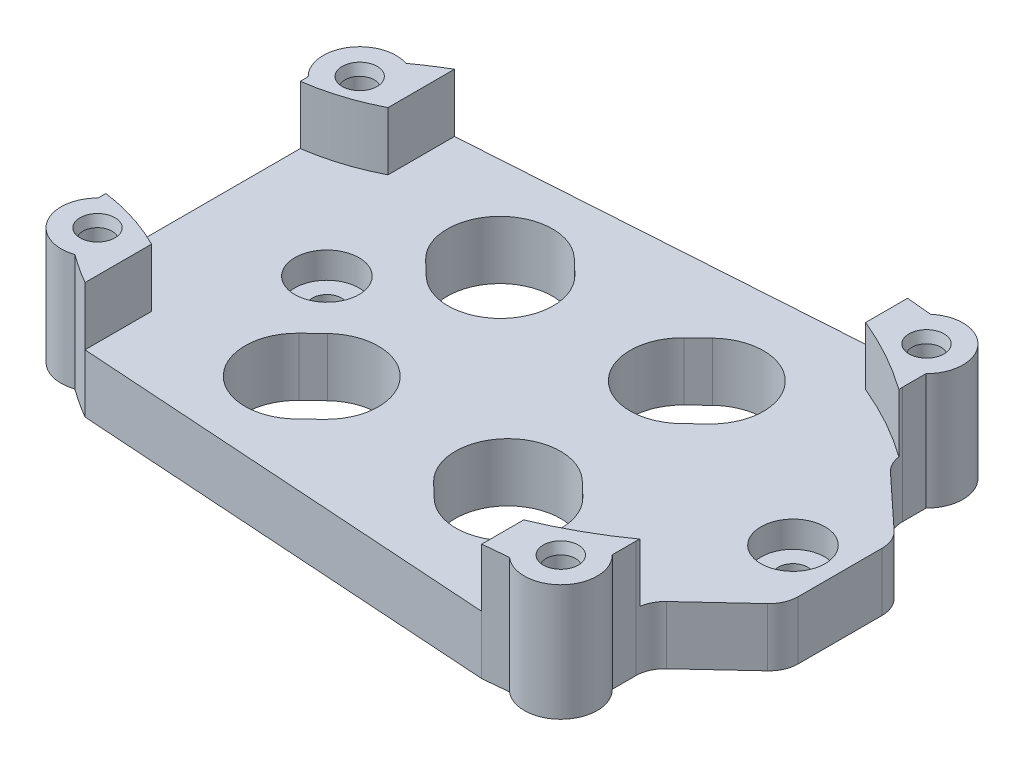
from build123d import *
from OCP.BRepFilletAPI import BRepFilletAPI_MakeChamfer

# Parameters (mm, degrees)
SKETCH1_R           = 1
BOSS_EXTRUDE1_DEPTH = 4
SKETCH1_5_R         = 1
BOSS_EXTRUDE2_DEPTH = 8
CUT_EXTRUDE1_DEPTH  = 7
SKETCH4_R           = 1
BOSS_EXTRUDE3_DEPTH = 4
SKETCH3_R           = 2
CUT_EXTRUDE2_DEPTH  = 1.8
MOVE_START          = 4
MOVE_FACE1_DEPTH    = 4
MOVE_FACE2_BY       = 0.2
MOVE_FACE2_2_BY     = 0.2
CHAMFER1_SIZE       = 0.7
CHAMFER1_SIZE2      = 0.2
CHAMFER2_SIZE       = 0.2
CHAMFER2_SIZE2      = 0.7
SKETCH5_R           = 1
CUT_EXTRUDE3_DEPTH  = 4
FILLET1_R           = 2


# Read off the part's stored shape, not the designer's step: Move Face1
with BuildPart() as part:
    # Sketch1 → Boss-Extrude1 (new body)
    with BuildSketch(Plane(origin=(0, 0, 0), x_dir=(1, 0, 0), z_dir=(0, 1, 0))):
        with BuildLine():
            Line((24.824168418, -41.434990566), (38.696876617, -40.141355505))
            ThreePointArc((38.696876617, -40.141355505), (42.164537627, -39.927592778), (42.070086822, -36.454633459))
            Line((42.070086822, -36.454633459), (42.070086822, -14.915347673))
            ThreePointArc((42.070086822, -14.915347673), (42.164537627, -11.442388354), (38.696876617, -11.228625627))
            Line((38.696876617, -11.228625627), (24.824168418, -9.934990566))
            ThreePointArc((24.824168418, -9.934990566), (14.849186159, -10.187088505), (5.767316865, -14.320304511))
            ThreePointArc((5.767316865, -14.320304511), (2.828547545, -15.371974531), (3.205984711, -18.470347673))
            Line((3.205984711, -18.470347673), (3.205984711, -32.899633459))
            ThreePointArc((3.205984711, -32.899633459), (2.828547545, -35.998006601), (5.767316865, -37.04967662))
            ThreePointArc((5.767316865, -37.04967662), (14.849186159, -41.182892626), (24.824168418, -41.434990566))
        make_face()
        with Locations(Location((4.955984711, -34.684990566, 0), (0, 0, 270))):
            Circle(SKETCH1_R, mode=Mode.SUBTRACT)
        with Locations(Location((24.824168418, -37.934990566, 0), (0, 0, 270))):
            Circle(SKETCH1_R, mode=Mode.SUBTRACT)
        with Locations(Location((40.320086822, -38.239990566, 0), (0, 0, 270))):
            Circle(SKETCH1_R, mode=Mode.SUBTRACT)
        with Locations(Location((4.955984711, -16.684990566, 0), (0, 0, 270))):
            Circle(SKETCH1_R, mode=Mode.SUBTRACT)
        with Locations(Location((24.824168418, -13.434990566, 0), (0, 0, 270))):
            Circle(SKETCH1_R, mode=Mode.SUBTRACT)
        with Locations(Location((40.320086822, -13.129990566, 0), (0, 0, 270))):
            Circle(SKETCH1_R, mode=Mode.SUBTRACT)
    extrude(amount=BOSS_EXTRUDE1_DEPTH)

    # Sketch1<5> → Boss-Extrude2 (add)
    # profile 1 of 8: a face of its own
    with BuildSketch(Plane(origin=(0, 0, 0), x_dir=(1, 0, 0), z_dir=(0, 1, 0))):
        with BuildLine():
            ThreePointArc((5.767316865, -37.04967662), (6.75947019, -37.734134037), (7.783460986, -38.369974447))
            Line((7.783460986, -38.369974447), (7.783460986, -33.244952788))
            ThreePointArc((7.783460986, -33.244952788), (6.373824255, -32.641654601), (4.909963227, -32.185414197))
            ThreePointArc((4.909963227, -32.185414197), (4.062798529, -31.99415486), (3.205984711, -31.852245597))
            Line((3.205984711, -31.852245597), (3.205984711, -32.899633459))
            Line((3.205984711, -32.899633459), (3.205984711, -34.684990566))
            ThreePointArc((3.205984711, -34.684990566), (3.718547844, -35.922427433), (4.955984711, -36.434990566))
            ThreePointArc((4.955984711, -36.434990566), (5.358522051, -36.746463253), (5.767316865, -37.04967662))
        make_face()
        with Locations(Location((4.955984711, -34.684990566, 0), (0, 0, 270))):
            Circle(SKETCH1_5_R, mode=Mode.SUBTRACT)
    # profile 2 of 8: a face of its own
    with BuildSketch(Plane(origin=(0, 0, 0), x_dir=(1, 0, 0), z_dir=(0, 1, 0))):
        with BuildLine():
            ThreePointArc((36.955984711, -14.488712586), (39.599003683, -15.793476237), (42.070086822, -17.400244917))
            Line((42.070086822, -17.400244917), (42.070086822, -14.915347673))
            Line((42.070086822, -14.915347673), (42.070086822, -13.129990566))
            ThreePointArc((42.070086822, -13.129990566), (41.557523689, -11.892553699), (40.320086822, -11.379990566))
            Line((40.320086822, -11.379990566), (38.696876617, -11.228625627))
            Line((38.696876617, -11.228625627), (36.955984711, -11.066286826))
            Line((36.955984711, -11.066286826), (36.955984711, -14.488712586))
        make_face()
        with Locations(Location((40.320086822, -13.129990566, 0), (0, 0, 270))):
            Circle(SKETCH1_5_R, mode=Mode.SUBTRACT)
    # profile 3 of 8: a face of its own
    with BuildSketch(Plane(origin=(0, 0, 0), x_dir=(1, 0, 0), z_dir=(0, 1, 0))):
        with BuildLine():
            Line((3.205984711, -18.470347673), (3.205984711, -19.517735535))
            ThreePointArc((3.205984711, -19.517735535), (5.55061073, -19.005071272), (7.783460986, -18.125028343))
            Line((7.783460986, -18.125028343), (7.783460986, -13.000006684))
            ThreePointArc((7.783460986, -13.000006684), (6.75947019, -13.635847094), (5.767316865, -14.320304511))
            ThreePointArc((5.767316865, -14.320304511), (5.358522051, -14.623517879), (4.955984711, -14.934990566))
            ThreePointArc((4.955984711, -14.934990566), (3.718547844, -15.447553699), (3.205984711, -16.684990566))
            Line((3.205984711, -16.684990566), (3.205984711, -18.470347673))
        make_face()
        with Locations(Location((4.955984711, -16.684990566, 0), (0, 0, 270))):
            Circle(SKETCH1_5_R, mode=Mode.SUBTRACT)
    # profile 4 of 8: a face of its own
    with BuildSketch(Plane(origin=(0, 0, 0), x_dir=(1, 0, 0), z_dir=(0, 1, 0))):
        with BuildLine():
            Line((36.955984711, -36.881268545), (36.955984711, -40.303694305))
            Line((36.955984711, -40.303694305), (38.696876617, -40.141355505))
            Line((38.696876617, -40.141355505), (40.320086822, -39.989990566))
            ThreePointArc((40.320086822, -39.989990566), (41.557523689, -39.477427433), (42.070086822, -38.239990566))
            Line((42.070086822, -38.239990566), (42.070086822, -36.454633459))
            Line((42.070086822, -36.454633459), (42.070086822, -33.969736214))
            ThreePointArc((42.070086822, -33.969736214), (39.599003683, -35.576504894), (36.955984711, -36.881268545))
        make_face()
        with Locations(Location((40.320086822, -38.239990566, 0), (0, 0, 270))):
            Circle(SKETCH1_5_R, mode=Mode.SUBTRACT)
    # profile 5 of 8: a face of its own
    with BuildSketch(Plane(origin=(0, 0, 0), x_dir=(1, 0, 0), z_dir=(0, 1, 0))):
        with BuildLine():
            ThreePointArc((5.767316865, -14.320304511), (2.828547545, -15.371974531), (3.205984711, -18.470347673))
            Line((3.205984711, -18.470347673), (3.205984711, -16.684990566))
            ThreePointArc((3.205984711, -16.684990566), (3.718547844, -15.447553699), (4.955984711, -14.934990566))
            ThreePointArc((4.955984711, -14.934990566), (5.358522051, -14.623517879), (5.767316865, -14.320304511))
        make_face()
    # profile 6 of 8: a face of its own
    with BuildSketch(Plane(origin=(0, 0, 0), x_dir=(1, 0, 0), z_dir=(0, 1, 0))):
        with BuildLine():
            ThreePointArc((3.205984711, -32.899633459), (2.828547545, -35.998006601), (5.767316865, -37.04967662))
            ThreePointArc((5.767316865, -37.04967662), (5.358522051, -36.746463253), (4.955984711, -36.434990566))
            ThreePointArc((4.955984711, -36.434990566), (3.718547844, -35.922427433), (3.205984711, -34.684990566))
            Line((3.205984711, -34.684990566), (3.205984711, -32.899633459))
        make_face()
    # profile 7 of 8: a face of its own
    with BuildSketch(Plane(origin=(0, 0, 0), x_dir=(1, 0, 0), z_dir=(0, 1, 0))):
        with BuildLine():
            Line((42.070086822, -13.129990566), (42.070086822, -14.915347673))
            ThreePointArc((42.070086822, -14.915347673), (42.164537627, -11.442388354), (38.696876617, -11.228625627))
            Line((38.696876617, -11.228625627), (40.320086822, -11.379990566))
            ThreePointArc((40.320086822, -11.379990566), (41.557523689, -11.892553699), (42.070086822, -13.129990566))
        make_face()
    # profile 8 of 8: a face of its own
    with BuildSketch(Plane(origin=(0, 0, 0), x_dir=(1, 0, 0), z_dir=(0, 1, 0))):
        with BuildLine():
            Line((40.320086822, -39.989990566), (38.696876617, -40.141355505))
            ThreePointArc((38.696876617, -40.141355505), (42.164537627, -39.927592778), (42.070086822, -36.454633459))
            Line((42.070086822, -36.454633459), (42.070086822, -38.239990566))
            ThreePointArc((42.070086822, -38.239990566), (41.557523689, -39.477427433), (40.320086822, -39.989990566))
        make_face()
    extrude(amount=BOSS_EXTRUDE2_DEPTH)

    # Sketch2 → Cut-Extrude1 (cut)
    # profile 1 of 7: a face of its own
    with BuildSketch(Plane(origin=(0, 4, 0), x_dir=(1, 0, 0), z_dir=(0, 1, 0))):
        with BuildLine():
            Line((15.133035567, -22.292628664), (14.144339339, -21.344272313))
            ThreePointArc((14.144339339, -21.344272313), (14.038042286, -16.240068072), (19.142246528, -16.13377102))
            Line((19.142246528, -16.13377102), (20.130942756, -17.08212737))
            ThreePointArc((20.130942756, -17.08212737), (20.237239809, -22.186331611), (15.133035567, -22.292628664))
        make_face()
        with BuildLine():
            ThreePointArc((17.757784702, -17.577123179), (15.481394445, -17.624529897), (15.528801164, -19.900920155))
            Line((15.528801164, -19.900920155), (16.517497393, -20.849276505))
            ThreePointArc((16.517497393, -20.849276505), (18.79388765, -20.801869786), (18.746480931, -18.525479529))
            Line((18.746480931, -18.525479529), (17.757784702, -17.577123179))
        make_face(mode=Mode.SUBTRACT)
    # profile 2 of 7: a face of its own
    with BuildSketch(Plane(origin=(0, 4, 0), x_dir=(1, 0, 0), z_dir=(0, 1, 0))):
        with BuildLine():
            ThreePointArc((32.636404248, -22.292628664), (27.532200006, -22.186331611), (27.638497059, -17.08212737))
            Line((27.638497059, -17.08212737), (28.627193287, -16.13377102))
            ThreePointArc((28.627193287, -16.13377102), (33.731397529, -16.240068072), (33.625100476, -21.344272313))
            Line((33.625100476, -21.344272313), (32.636404248, -22.292628664))
        make_face()
        with BuildLine():
            Line((29.022958884, -18.525479529), (30.011655113, -17.577123179))
            ThreePointArc((30.011655113, -17.577123179), (32.28804537, -17.624529897), (32.240638651, -19.900920155))
            Line((32.240638651, -19.900920155), (31.251942422, -20.849276505))
            ThreePointArc((31.251942422, -20.849276505), (28.975552165, -20.801869786), (29.022958884, -18.525479529))
        make_face(mode=Mode.SUBTRACT)
    # profile 3 of 7: a face of its own
    with BuildSketch(Plane(origin=(0, 4, 0), x_dir=(1, 0, 0), z_dir=(0, 1, 0))):
        with BuildLine():
            ThreePointArc((30.011655113, -17.577123179), (32.28804537, -17.624529897), (32.240638651, -19.900920155))
            Line((32.240638651, -19.900920155), (31.251942422, -20.849276505))
            ThreePointArc((31.251942422, -20.849276505), (28.975552165, -20.801869786), (29.022958884, -18.525479529))
            Line((29.022958884, -18.525479529), (30.011655113, -17.577123179))
        make_face()
    # profile 4 of 7: a face of its own
    with BuildSketch(Plane(origin=(0, 4, 0), x_dir=(1, 0, 0), z_dir=(0, 1, 0))):
        with BuildLine():
            ThreePointArc((33.623989066, -30.028201915), (33.728979595, -35.132433198), (28.624748312, -35.237423727))
            Line((28.624748312, -35.237423727), (27.636294866, -34.288814332))
            ThreePointArc((27.636294866, -34.288814332), (27.531304337, -29.184583049), (32.63553562, -29.07959252))
            Line((32.63553562, -29.07959252), (33.623989066, -30.028201915))
        make_face()
        with BuildLine():
            Line((30.009579546, -33.794425995), (29.0211261, -32.8458166))
            ThreePointArc((29.0211261, -32.8458166), (28.974302069, -30.569414283), (31.250704386, -30.522590252))
            Line((31.250704386, -30.522590252), (32.239157832, -31.471199647))
            ThreePointArc((32.239157832, -31.471199647), (32.285981863, -33.747601964), (30.009579546, -33.794425995))
        make_face(mode=Mode.SUBTRACT)
    # profile 5 of 7: a face of its own
    with BuildSketch(Plane(origin=(0, 4, 0), x_dir=(1, 0, 0), z_dir=(0, 1, 0))):
        with BuildLine():
            ThreePointArc((29.0211261, -32.8458166), (28.974302069, -30.569414283), (31.250704386, -30.522590252))
            Line((31.250704386, -30.522590252), (32.239157832, -31.471199647))
            ThreePointArc((32.239157832, -31.471199647), (32.285981863, -33.747601964), (30.009579546, -33.794425995))
            Line((30.009579546, -33.794425995), (29.0211261, -32.8458166))
        make_face()
    # profile 6 of 7: a face of its own
    with BuildSketch(Plane(origin=(0, 4, 0), x_dir=(1, 0, 0), z_dir=(0, 1, 0))):
        with BuildLine():
            Line((14.145450749, -30.028201915), (15.133904195, -29.07959252))
            ThreePointArc((15.133904195, -29.07959252), (20.238135478, -29.184583049), (20.133144949, -34.288814332))
            Line((20.133144949, -34.288814332), (19.144691503, -35.237423727))
            ThreePointArc((19.144691503, -35.237423727), (14.04046022, -35.132433198), (14.145450749, -30.028201915))
        make_face()
        with BuildLine():
            ThreePointArc((18.748313715, -32.8458166), (18.795137746, -30.569414283), (16.518735429, -30.522590252))
            Line((16.518735429, -30.522590252), (15.530281983, -31.471199647))
            ThreePointArc((15.530281983, -31.471199647), (15.483457952, -33.747601964), (17.759860269, -33.794425995))
            Line((17.759860269, -33.794425995), (18.748313715, -32.8458166))
        make_face(mode=Mode.SUBTRACT)
    # profile 7 of 7: a face of its own
    with BuildSketch(Plane(origin=(0, 4, 0), x_dir=(1, 0, 0), z_dir=(0, 1, 0))):
        with BuildLine():
            Line((17.759860269, -33.794425995), (18.748313715, -32.8458166))
            ThreePointArc((18.748313715, -32.8458166), (18.795137746, -30.569414283), (16.518735429, -30.522590252))
            Line((16.518735429, -30.522590252), (15.530281983, -31.471199647))
            ThreePointArc((15.530281983, -31.471199647), (15.483457952, -33.747601964), (17.759860269, -33.794425995))
        make_face()
    extrude(amount=-CUT_EXTRUDE1_DEPTH, mode=Mode.SUBTRACT)


with BuildPart() as cut_extrude1_kept_piece:
    # of the separate pieces the step leaves, the one the design keeps (cut_extrude1_pieces_kept)
    add(part.part.solids().sort_by_distance((24.824168418, 0, 41.434990566))[0])

    # Sketch4 → Boss-Extrude3 (add)
    with BuildSketch(Plane(origin=(0, 4, 0), x_dir=(1, 0, 0), z_dir=(0, 1, 0))):
        with Locations((24.824168418, -13.434990566)):
            Circle(SKETCH4_R)
        with Locations((24.824168418, -37.934990566)):
            Circle(SKETCH4_R)
        Polygon((42.070086822, -17.400244917), (46.943557579, -21.934990566), (46.943557579, -29.434990566), (42.070086822, -33.969736214), align=None)
    extrude(amount=-BOSS_EXTRUDE3_DEPTH)

    # Sketch3 → Cut-Extrude2 (cut)
    with BuildSketch(Plane(origin=(0, 4, 0), x_dir=(1, 0, 0), z_dir=(0, 1, 0))):
        with Locations(Location((11.705984711, -25.684990566, 0), (0, 0, 270))):
            Circle(SKETCH3_R)
        with Locations(Location((43.705984711, -25.684990566, 0), (0, 0, 270))):
            Circle(SKETCH3_R)
    extrude(amount=-CUT_EXTRUDE2_DEPTH, mode=Mode.SUBTRACT)

    # Move Face1 outline → Move Face1 (cut)
    with BuildSketch(Plane(origin=(0, 0, 0), x_dir=(1, 0, 0), z_dir=(0, 1, 0)).offset(MOVE_START)):
        with BuildLine():
            Line((7.783460986, -18.125028343), (7.783460986, -17.565930728))
            ThreePointArc((7.783460986, -17.565930728), (5.555025764, -18.48020931), (3.205984711, -19.012970982))
            Line((3.205984711, -19.012970982), (3.205984711, -19.517735535))
            ThreePointArc((3.205984711, -19.517735535), (5.550610731, -19.005071272), (7.783460986, -18.125028343))
        make_face()
        with BuildLine():
            ThreePointArc((7.783460986, -33.244952788), (5.550610731, -32.364909859), (3.205984711, -31.852245597))
            Line((3.205984711, -31.852245597), (3.205984711, -32.357010149))
            ThreePointArc((3.205984711, -32.357010149), (5.555025764, -32.889771821), (7.783460986, -33.804050403))
            Line((7.783460986, -33.804050403), (7.783460986, -33.244952788))
        make_face()
        with BuildLine():
            ThreePointArc((42.070086822, -16.782223018), (39.594576687, -15.217486228), (36.955984711, -13.946902097))
            Line((36.955984711, -13.946902097), (36.955984711, -14.488712586))
            ThreePointArc((36.955984711, -14.488712586), (39.599003683, -15.793476237), (42.070086822, -17.400244917))
            Line((42.070086822, -17.400244917), (42.070086822, -16.782223018))
        make_face()
        with BuildLine():
            ThreePointArc((36.955984711, -37.423079034), (39.594576687, -36.152494903), (42.070086822, -34.587758113))
            Line((42.070086822, -34.587758113), (42.070086822, -33.969736214))
            ThreePointArc((42.070086822, -33.969736214), (39.599003683, -35.576504894), (36.955984711, -36.881268545))
            Line((36.955984711, -36.881268545), (36.955984711, -37.423079034))
        make_face()
    extrude(amount=MOVE_FACE1_DEPTH, mode=Mode.SUBTRACT)

    # Move Face2: a curved face moved inward by 0.2
    add(Solid.thicken(cut_extrude1_kept_piece.faces().sort_by_distance((11.705984711, 3.1, 23.684990566))[0], -MOVE_FACE2_BY), mode=Mode.SUBTRACT)

    # Move Face2 2: a curved face moved inward by 0.2
    add(Solid.thicken(cut_extrude1_kept_piece.faces().sort_by_distance((43.705984711, 3.1, 23.684990566))[0], -MOVE_FACE2_2_BY), mode=Mode.SUBTRACT)

    # Chamfer1: one chamfer whose edges measure the first distance from different faces: ONE call of the kernel's chamfer builder (chamfer() names one face for all edges)
    chamfer1_edges_1 = [cut_extrude1_kept_piece.edges().sort_by_distance(p)[0] for p in [
        (40.320086822, 8, 12.129990566),
    ]]
    chamfer1_side_1 = [cut_extrude1_kept_piece.faces().sort_by_distance(p)[0] for p in [
        (40.320086822, 4, 12.129990566),
    ]]
    chamfer1_edges_2 = [cut_extrude1_kept_piece.edges().sort_by_distance(p)[0] for p in [
        (4.955984711, 8, 15.684990566),
    ]]
    chamfer1_side_2 = [cut_extrude1_kept_piece.faces().sort_by_distance(p)[0] for p in [
        (4.955984711, 4, 15.684990566),
    ]]
    chamfer1 = BRepFilletAPI_MakeChamfer(cut_extrude1_kept_piece.part.solid().wrapped)
    for e in chamfer1_edges_1:
        chamfer1.Add(CHAMFER1_SIZE, CHAMFER1_SIZE2, e.wrapped, chamfer1_side_1[0].wrapped)  # the first distance lies on this face
    for e in chamfer1_edges_2:
        chamfer1.Add(CHAMFER1_SIZE, CHAMFER1_SIZE2, e.wrapped, chamfer1_side_2[0].wrapped)  # the first distance lies on this face
    add(Compound.cast(chamfer1.Shape()), mode=Mode.REPLACE)

    # Chamfer2: one chamfer whose edges measure the first distance from different faces: ONE call of the kernel's chamfer builder (chamfer() names one face for all edges)
    chamfer2_edges_1 = [cut_extrude1_kept_piece.edges().sort_by_distance(p)[0] for p in [
        (40.320086822, 8, 37.239990566),
    ]]
    chamfer2_side_1 = [cut_extrude1_kept_piece.faces().sort_by_distance(p)[0] for p in [
        (41.985094082, 8, 35.521195786),
    ]]
    chamfer2_edges_2 = [cut_extrude1_kept_piece.edges().sort_by_distance(p)[0] for p in [
        (4.955984711, 8, 33.684990566),
    ]]
    chamfer2_side_2 = [cut_extrude1_kept_piece.faces().sort_by_distance(p)[0] for p in [
        (3.286320097, 8, 32.628321804),
    ]]
    chamfer2 = BRepFilletAPI_MakeChamfer(cut_extrude1_kept_piece.part.solid().wrapped)
    for e in chamfer2_edges_1:
        chamfer2.Add(CHAMFER2_SIZE, CHAMFER2_SIZE2, e.wrapped, chamfer2_side_1[0].wrapped)  # the first distance lies on this face
    for e in chamfer2_edges_2:
        chamfer2.Add(CHAMFER2_SIZE, CHAMFER2_SIZE2, e.wrapped, chamfer2_side_2[0].wrapped)  # the first distance lies on this face
    add(Compound.cast(chamfer2.Shape()), mode=Mode.REPLACE)

    # Sketch5 → Cut-Extrude3 (cut)
    with BuildSketch(Plane(origin=(0, 4, 0), x_dir=(1, 0, 0), z_dir=(0, 1, 0))):
        with Locations(Location((11.705984711, -25.684990566, 0), (0, 0, 270))):
            Circle(SKETCH5_R)
        with Locations(Location((43.705984711, -25.684990566, 0), (0, 0, 270))):
            Circle(SKETCH5_R)
        Polygon((7.783460986, -38.369974447), (36.955984711, -40.303694305), (18.435611248, -45.125660457), align=None)
        Polygon((7.783460986, -13.000006684), (36.955984711, -11.066286826), (18.435611248, -6.244320675), align=None)
    extrude(amount=-CUT_EXTRUDE3_DEPTH, mode=Mode.SUBTRACT)

    # Fillet1
    # the kernel refuses this fillet: 2 mm, written as the material it adds along each edge
    with BuildSketch(Plane(origin=(42.070086822, 9.225462477, 17.400244917), x_dir=(0, 0, -1), z_dir=(0, -1, 0))) as fillet1_piece_1_section:
        with BuildLine():
            CenterArc((FILLET1_R * 0.435455206446, FILLET1_R), FILLET1_R, 222.93806399, 47.06193601)
            Line((-FILLET1_R * 0.296635299284, FILLET1_R * 0.31879262231), (-FILLET1_R * 0.311277109399, FILLET1_R * 0.305168474756))
            Line((-FILLET1_R * 0.311277109399, FILLET1_R * 0.305168474756), (-FILLET1_R * 0.00870910412891, -FILLET1_R * 0.02))
            Line((-FILLET1_R * 0.00870910412891, -FILLET1_R * 0.02), (FILLET1_R * 0.435455206446, -FILLET1_R * 0.02))
            Line((FILLET1_R * 0.435455206446, -FILLET1_R * 0.02), (FILLET1_R * 0.435455206446, 0))
        make_face()
    fillet1_piece_1 = extrude(amount=9.225462477, mode=Mode.PRIVATE)
    fillet1_piece_1 = split(fillet1_piece_1, bisect_by=Plane(origin=(42.053770569, 8, 16.658681976), z_dir=(0, -1, 0)), keep=Keep.TOP, mode=Mode.PRIVATE)
    fillet1_piece_1 = fillet1_piece_1 - Plane(origin=(27.230170636, 6, 37.51931267), x_dir=(0.5819574976530117, 0, -0.8132192022606481), z_dir=(0, -1, 0)) * Cylinder(25.499999993, 22, mode=Mode.PRIVATE)
    fillet1_piece_1 = split(fillet1_piece_1, bisect_by=Plane(origin=(42.053770569, 4, 16.658681976), z_dir=(0, 1, 0)), keep=Keep.TOP, mode=Mode.PRIVATE)
    add(fillet1_piece_1)
    with BuildSketch(Plane(origin=(42.070086822, 4, 17.400244917), x_dir=(0, 0, -1), z_dir=(0, -1, 0))) as fillet1_piece_2_section:
        with BuildLine():
            CenterArc((FILLET1_R * 0.435455206446, FILLET1_R), FILLET1_R, 222.93806399, 47.06193601)
            Line((-FILLET1_R * 0.296635299284, FILLET1_R * 0.31879262231), (-FILLET1_R * 0.311277109399, FILLET1_R * 0.305168474756))
            Line((-FILLET1_R * 0.311277109399, FILLET1_R * 0.305168474756), (-FILLET1_R * 0.00870910412891, -FILLET1_R * 0.02))
            Line((-FILLET1_R * 0.00870910412891, -FILLET1_R * 0.02), (FILLET1_R * 0.435455206446, -FILLET1_R * 0.02))
            Line((FILLET1_R * 0.435455206446, -FILLET1_R * 0.02), (FILLET1_R * 0.435455206446, 0))
        make_face()
    fillet1_piece_2 = extrude(amount=4, mode=Mode.PRIVATE)
    fillet1_piece_2 = fillet1_piece_2 - Plane(origin=(27.230170636, 2, 37.51931267), x_dir=(0.5819574976530117, 0, -0.8132192022606481), z_dir=(0, -1, 0)) * Cylinder(25.499999993, 12, mode=Mode.PRIVATE)
    add(fillet1_piece_2)
    with BuildSketch(Plane(origin=(42.070086822, 4, 17.400244917), x_dir=(0, 0, -1), z_dir=(0, -1, 0))) as fillet1_piece_3_section:
        with BuildLine():
            CenterArc((FILLET1_R * 0.435455206446, FILLET1_R), FILLET1_R, 222.93806399, 47.06193601)
            Line((-FILLET1_R * 0.296635299284, FILLET1_R * 0.31879262231), (-FILLET1_R * 0.311277109399, FILLET1_R * 0.305168474756))
            Line((-FILLET1_R * 0.311277109399, FILLET1_R * 0.305168474756), (-FILLET1_R * 0.00870910412891, -FILLET1_R * 0.02))
            Line((-FILLET1_R * 0.00870910412891, -FILLET1_R * 0.02), (FILLET1_R * 0.435455206446, -FILLET1_R * 0.02))
            Line((FILLET1_R * 0.435455206446, -FILLET1_R * 0.02), (FILLET1_R * 0.435455206446, 0))
        make_face()
    fillet1_piece_3 = extrude(amount=4, mode=Mode.PRIVATE)
    fillet1_piece_3 = fillet1_piece_3 & Plane(origin=(27.230170636, 2, 37.51931267), x_dir=(0.5819574976530117, 0, -0.8132192022606481), z_dir=(0, -1, 0)) * Cylinder(25.499999993, 12, mode=Mode.PRIVATE)
    add(fillet1_piece_3)
    with BuildSketch(Plane(origin=(42.070086822, 9.225462477, 33.969736214), x_dir=(0.7320905057300818, 0, -0.6812073776904307), z_dir=(0, -1, 0))) as fillet1_piece_4_section:
        with BuildLine():
            CenterArc((FILLET1_R * 0.435455206446, FILLET1_R), FILLET1_R, 222.93806399, 47.06193601)
            Line((-FILLET1_R * 0.296635299284, FILLET1_R * 0.31879262231), (-FILLET1_R * 0.311277109399, FILLET1_R * 0.305168474756))
            Line((-FILLET1_R * 0.311277109399, FILLET1_R * 0.305168474756), (-FILLET1_R * 0.00870910412891, -FILLET1_R * 0.02))
            Line((-FILLET1_R * 0.00870910412891, -FILLET1_R * 0.02), (FILLET1_R * 0.435455206446, -FILLET1_R * 0.02))
            Line((FILLET1_R * 0.435455206446, -FILLET1_R * 0.02), (FILLET1_R * 0.435455206446, 0))
        make_face()
    fillet1_piece_4 = extrude(amount=9.225462477, mode=Mode.PRIVATE)
    fillet1_piece_4 = split(fillet1_piece_4, bisect_by=Plane(origin=(42.053770569, 4, 34.711299155), z_dir=(0, 1, 0)), keep=Keep.TOP, mode=Mode.PRIVATE)
    fillet1_piece_4 = fillet1_piece_4 - Plane(origin=(27.230170636, 6, 13.850668461), x_dir=(0.38140447363659175, 0, 0.9244082580169839), z_dir=(0, -1, 0)) * Cylinder(25.499999993, 22, mode=Mode.PRIVATE)
    fillet1_piece_4 = split(fillet1_piece_4, bisect_by=Plane(origin=(42.053770569, 8, 34.711299155), z_dir=(0, -1, 0)), keep=Keep.TOP, mode=Mode.PRIVATE)
    add(fillet1_piece_4)
    with BuildSketch(Plane(origin=(42.070086822, 4, 33.969736214), x_dir=(0.7320905057300818, 0, -0.6812073776904307), z_dir=(0, -1, 0))) as fillet1_piece_5_section:
        with BuildLine():
            CenterArc((FILLET1_R * 0.435455206446, FILLET1_R), FILLET1_R, 222.93806399, 47.06193601)
            Line((-FILLET1_R * 0.296635299284, FILLET1_R * 0.31879262231), (-FILLET1_R * 0.311277109399, FILLET1_R * 0.305168474756))
            Line((-FILLET1_R * 0.311277109399, FILLET1_R * 0.305168474756), (-FILLET1_R * 0.00870910412891, -FILLET1_R * 0.02))
            Line((-FILLET1_R * 0.00870910412891, -FILLET1_R * 0.02), (FILLET1_R * 0.435455206446, -FILLET1_R * 0.02))
            Line((FILLET1_R * 0.435455206446, -FILLET1_R * 0.02), (FILLET1_R * 0.435455206446, 0))
        make_face()
    fillet1_piece_5 = extrude(amount=4, mode=Mode.PRIVATE)
    fillet1_piece_5 = fillet1_piece_5 & Plane(origin=(27.230170636, 2, 13.850668461), x_dir=(0.38140447363659175, 0, 0.9244082580169839), z_dir=(0, -1, 0)) * Cylinder(25.499999993, 12, mode=Mode.PRIVATE)
    add(fillet1_piece_5)
    with BuildSketch(Plane(origin=(42.070086822, 4, 33.969736214), x_dir=(0.7320905057300818, 0, -0.6812073776904307), z_dir=(0, -1, 0))) as fillet1_piece_6_section:
        with BuildLine():
            CenterArc((FILLET1_R * 0.435455206446, FILLET1_R), FILLET1_R, 222.93806399, 47.06193601)
            Line((-FILLET1_R * 0.296635299284, FILLET1_R * 0.31879262231), (-FILLET1_R * 0.311277109399, FILLET1_R * 0.305168474756))
            Line((-FILLET1_R * 0.311277109399, FILLET1_R * 0.305168474756), (-FILLET1_R * 0.00870910412891, -FILLET1_R * 0.02))
            Line((-FILLET1_R * 0.00870910412891, -FILLET1_R * 0.02), (FILLET1_R * 0.435455206446, -FILLET1_R * 0.02))
            Line((FILLET1_R * 0.435455206446, -FILLET1_R * 0.02), (FILLET1_R * 0.435455206446, 0))
        make_face()
    fillet1_piece_6 = extrude(amount=4, mode=Mode.PRIVATE)
    fillet1_piece_6 = fillet1_piece_6 - Plane(origin=(27.230170636, 2, 13.850668461), x_dir=(0.38140447363659175, 0, 0.9244082580169839), z_dir=(0, -1, 0)) * Cylinder(25.499999993, 12, mode=Mode.PRIVATE)
    add(fillet1_piece_6)
    # the kernel refuses this fillet: 2 mm, written as the material it takes off along each edge
    with BuildSketch(Plane(origin=(46.943557579, 9.225462477, 29.434990566), x_dir=(0, 0, -1), z_dir=(0, -1, 0)), Plane(origin=(46.943557579, 9.225462477, 21.934990566), x_dir=(-0.7320905057300858, 0, -0.6812073776904263), z_dir=(0, -1, 0))) as fillet1_2_piece_1:
        with BuildLine():
            CenterArc((FILLET1_R * 0.435455206446, -FILLET1_R), FILLET1_R, 90, 47.06193601)
            Line((-FILLET1_R * 0.296635299284, -FILLET1_R * 0.31879262231), (-FILLET1_R * 0.311277109399, -FILLET1_R * 0.305168474756))
            Line((-FILLET1_R * 0.311277109399, -FILLET1_R * 0.305168474756), (-FILLET1_R * 0.00870910412891, FILLET1_R * 0.02))
            Line((-FILLET1_R * 0.00870910412891, FILLET1_R * 0.02), (FILLET1_R * 0.435455206446, FILLET1_R * 0.02))
            Line((FILLET1_R * 0.435455206446, FILLET1_R * 0.02), (FILLET1_R * 0.435455206446, 0))
        make_face()
    extrude(amount=14.450924955, mode=Mode.SUBTRACT)


solid = cut_extrude1_kept_piece.part
